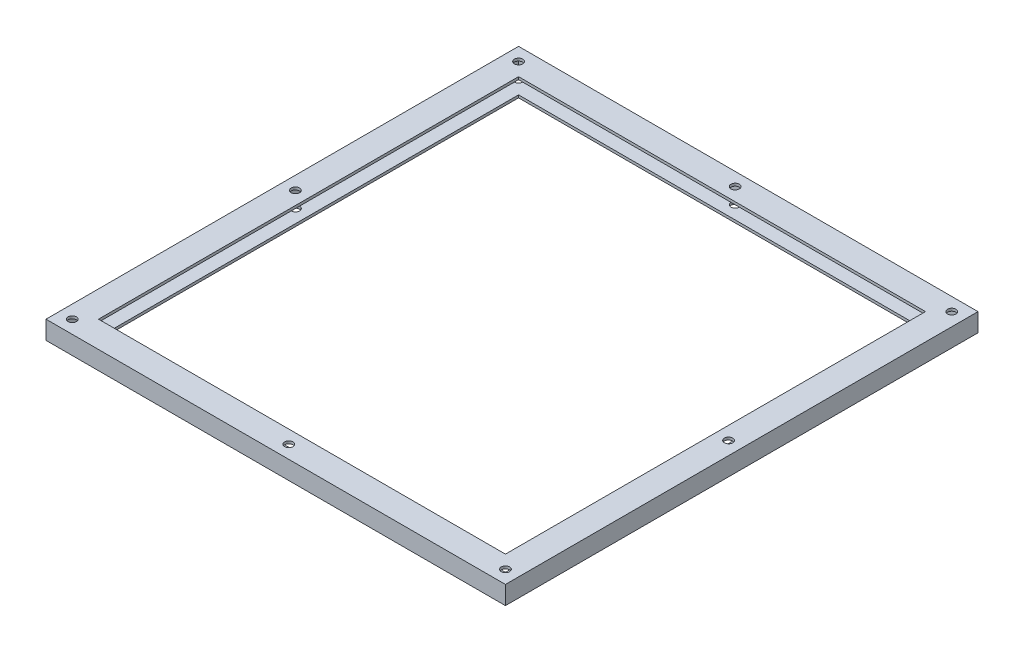
from build123d import *

# Parameters (mm, degrees)
ESQUISSE1_W             = 350
ESQUISSE1_H             = 360
ESQUISSE1_R             = 3.175
ESQUISSE1_W_2           = 310
ESQUISSE1_H_2           = 320
BOSS_EXTRU_2_DEPTH      = 14
ENL_V_START             = 2
ESQUISSE1_4_W           = 346
ESQUISSE1_4_H           = 356
ENL_V_MAT_EXTRU_1_DEPTH = 10


with BuildPart() as part:
    # Esquisse1 → Boss.-Extru.2 (new body)
    with BuildSketch(Plane(origin=(0, 0, 0), x_dir=(1, 0, 0), z_dir=(0, 1, 0))):
        with Locations((175, 180)):
            Rectangle(ESQUISSE1_W, ESQUISSE1_H)
        with Locations((10, 350)):
            Circle(ESQUISSE1_R, mode=Mode.SUBTRACT)
        with Locations((340, 180)):
            Circle(ESQUISSE1_R, mode=Mode.SUBTRACT)
        with Locations((175, 350)):
            Circle(ESQUISSE1_R, mode=Mode.SUBTRACT)
        with Locations((340, 350)):
            Circle(ESQUISSE1_R, mode=Mode.SUBTRACT)
        with Locations((10, 10)):
            Circle(ESQUISSE1_R, mode=Mode.SUBTRACT)
        with Locations((10, 180)):
            Circle(ESQUISSE1_R, mode=Mode.SUBTRACT)
        with Locations((175, 10)):
            Circle(ESQUISSE1_R, mode=Mode.SUBTRACT)
        with Locations((340, 10)):
            Circle(ESQUISSE1_R, mode=Mode.SUBTRACT)
        with Locations((175, 180)):
            Rectangle(ESQUISSE1_W_2, ESQUISSE1_H_2, mode=Mode.SUBTRACT)
    extrude(amount=BOSS_EXTRU_2_DEPTH)

    # Esquisse1<4> → Enlèv. mat.-Extru.1 (cut)
    with BuildSketch(Plane(origin=(0, 0, 0), x_dir=(1, 0, 0), z_dir=(0, 1, 0)).offset(ENL_V_START)):
        with Locations((175, 180)):
            Rectangle(ESQUISSE1_4_W, ESQUISSE1_4_H)
    extrude(amount=ENL_V_MAT_EXTRU_1_DEPTH, mode=Mode.SUBTRACT)


solid = part.part
